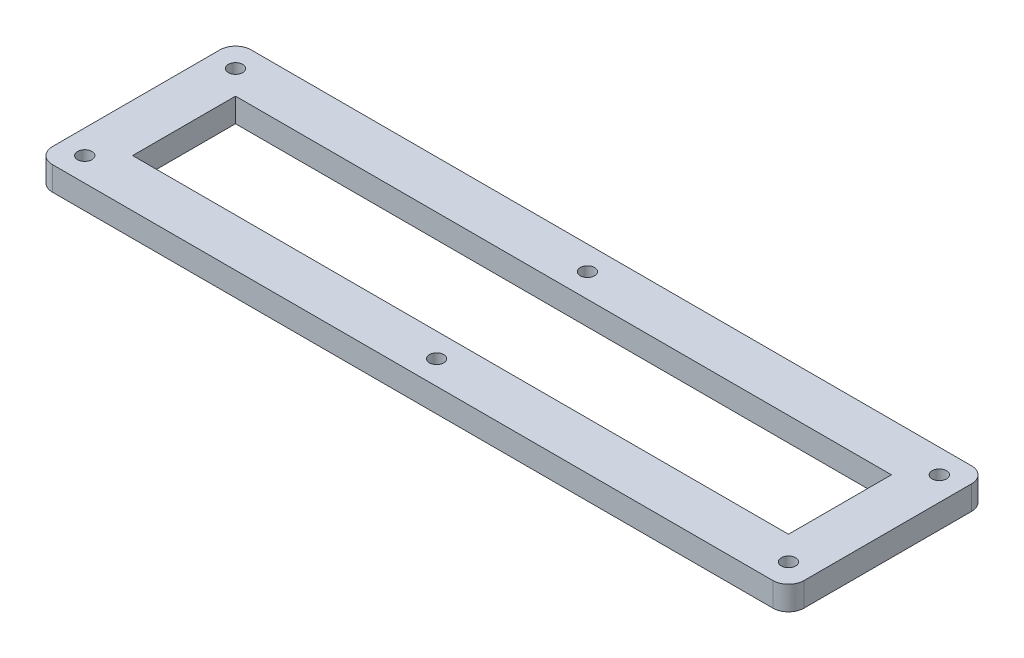
from build123d import *

# Parameters (mm, degrees)
SKETCH1_W             = 79.756
SKETCH1_H             = 42.164
PLATE_DEPTH           = 5.08
FILLET1_R             = 3.302
SKETCH3_W             = 69.596
SKETCH3_H             = 21.844
CENTERHOLE_DEPTH      = 46.392862963
SKETCH2_R             = 1.524
F_4_40THRUHOLES_DEPTH = 46.392862963
FILLET1_OF_MIRROR1_R  = 3.302


with BuildPart() as part:
    # Sketch1 → Plate (new body)
    with BuildSketch(Plane(origin=(0, 0, 0), x_dir=(1, 0, 0), z_dir=(0, 1, 0))):
        Rectangle(SKETCH1_W, SKETCH1_H)
    plate = extrude(amount=PLATE_DEPTH)

    # Fillet1
    fillet1_edges = [part.edges().sort_by_distance(p)[0] for p in [
        (-39.878, 2.54, -21.082),
        (-39.878, 2.54, 21.082),
    ]]
    fillet(fillet1_edges, radius=FILLET1_R)

    # Sketch3 → CenterHole (cut, through all)
    with BuildSketch(Plane(origin=(0, 5.08, 0), x_dir=(1, 0, 0), z_dir=(0, 1, 0))):
        with Locations((5.08, 0)):
            Rectangle(SKETCH3_W, SKETCH3_H)
    centerhole = extrude(amount=-CENTERHOLE_DEPTH, mode=Mode.SUBTRACT)

    # Sketch2 → 4-40ThruHoles (cut, through all)
    with BuildSketch(Plane(origin=(0, 5.08, 0), x_dir=(1, 0, 0), z_dir=(0, 1, 0))):
        with Locations((-34.798, 16.002)):
            Circle(SKETCH2_R)
        with Locations((39.878, 16.002)):
            Circle(SKETCH2_R)
        with Locations((-34.798, -16.002)):
            Circle(SKETCH2_R)
        with Locations((39.878, -16.002)):
            Circle(SKETCH2_R)
    f_4_40thruholes = extrude(amount=-F_4_40THRUHOLES_DEPTH, mode=Mode.SUBTRACT)

    # Mirror1: Plate, CenterHole, 4-40ThruHoles across plane
    add(plate.mirror(Plane(origin=(39.878, 5.08, -21.082), x_dir=(0, 0, 1), z_dir=(-1, 0, 0))))
    add(centerhole.mirror(Plane(origin=(39.878, 5.08, -21.082), x_dir=(0, 0, 1), z_dir=(-1, 0, 0))), mode=Mode.SUBTRACT)
    add(f_4_40thruholes.mirror(Plane(origin=(39.878, 5.08, -21.082), x_dir=(0, 0, 1), z_dir=(-1, 0, 0))), mode=Mode.SUBTRACT)

    # Fillet1 of Mirror1
    fillet1_of_mirror1_edges = [part.edges().sort_by_distance(p)[0] for p in [
        (119.634, 2.54, -21.082),
        (119.634, 2.54, 21.082),
    ]]
    fillet(fillet1_of_mirror1_edges, radius=FILLET1_OF_MIRROR1_R)


solid = part.part
